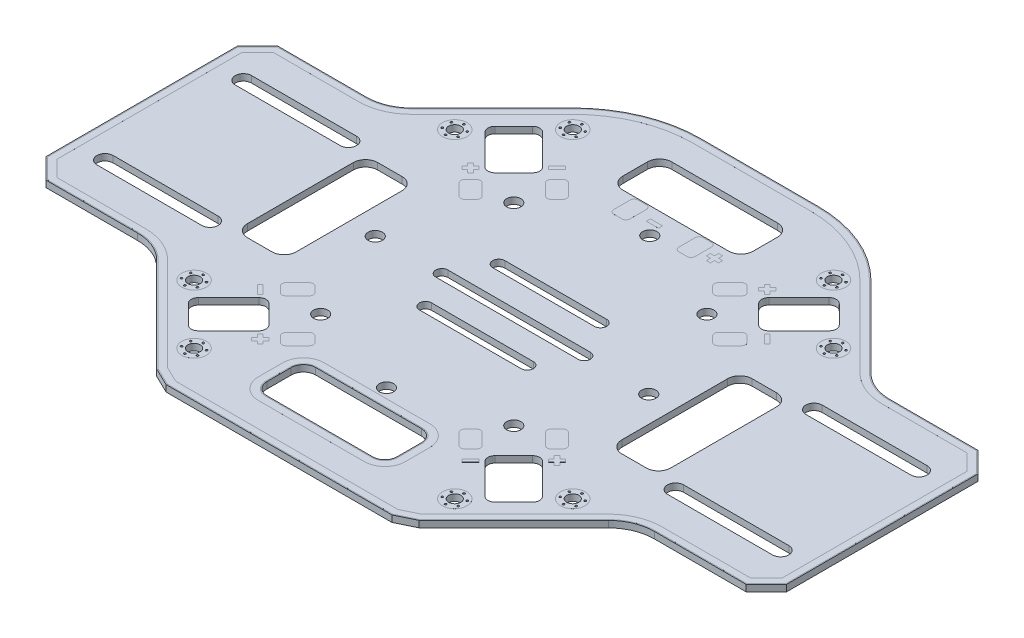
from build123d import *

# Parameters (mm, degrees)
BOSS_EXTRUDE1_DEPTH      = 0.8
BOSS_EXTRUDE1_DEPTH_BACK = 0.8
SKETCH1_R                = 1.5
SKETCH2_R                = 3
SKETCH2_R_2              = 0.25
SKETCH2_R_3              = 1.5
BOSS_EXTRUDE2_DEPTH      = 0.001
BOSS_EXTRUDE4_DEPTH      = 0.001
SKETCH6_R                = 0.25
CUT_EXTRUDE2_DEPTH       = 1.6
SKETCH7_W                = 3
SKETCH7_H                = 1
BOSS_EXTRUDE5_DEPTH      = 0.001
ESBO_O1_R                = 1.75
CORTE_EXTRUS_O1_DEPTH    = 110.18743785
ESBO_O2_R                = 1.75
CORTE_EXTRUS_O2_DEPTH    = 110.18743785


with BuildPart() as part:
    # Sketch1 → Boss-Extrude1 (new, two sides: drawn at the far end of the back side and taken through both)
    with BuildSketch(Plane(origin=(0, 0, 0), x_dir=(1, 0, 0), z_dir=(0, 1, 0)).offset(-BOSS_EXTRUDE1_DEPTH_BACK)):
        with BuildLine():
            Line((-27.75, -57.681401017), (27.75, -57.681401017))
            Line((27.75, -57.681401017), (32.25, -55.501951545))
            Line((32.25, -55.501951545), (55.501951545, -32.25))
            ThreePointArc((55.501951545, -32.25), (59.171487368, -29.798094552), (63.5, -28.937099858))
            Line((63.5, -28.937099858), (86, -28.937099858))
            Line((86, -28.937099858), (91, -23.937099858))
            Line((91, -23.937099858), (91, 23.062900142))
            Line((91, 23.062900142), (86, 28.062900142))
            Line((86, 28.062900142), (64.302117422, 28.062900142))
            ThreePointArc((64.302117422, 28.062900142), (60.040200145, 28.910648198), (56.427121139, 31.324830407))
            Line((56.427121139, 31.324830407), (36.628131265, 51.12382028))
            ThreePointArc((36.628131265, 51.12382028), (26.443529141, 57.928953855), (14.429971817, 60.318598983))
            Line((14.429971817, 60.318598983), (-14.429971817, 60.318598983))
            ThreePointArc((-14.429971817, 60.318598983), (-26.443529141, 57.928953855), (-36.628131265, 51.12382028))
            Line((-36.628131265, 51.12382028), (-56.427121139, 31.324830407))
            ThreePointArc((-56.427121139, 31.324830407), (-60.040200145, 28.910648198), (-64.302117422, 28.062900142))
            Line((-64.302117422, 28.062900142), (-86, 28.062900142))
            Line((-86, 28.062900142), (-91, 23.062900142))
            Line((-91, 23.062900142), (-91, -23.937099858))
            Line((-91, -23.937099858), (-86, -28.937099858))
            Line((-86, -28.937099858), (-63.5, -28.937099858))
            ThreePointArc((-63.5, -28.937099858), (-59.171487368, -29.798094552), (-55.501951545, -32.25))
            Line((-55.501951545, -32.25), (-32.25, -55.501951545))
            Line((-32.25, -55.501951545), (-27.75, -57.681401017))
        make_face()
        with Locations(Location((-32.031937188, 46.527626202, 0), (0, 0, 270))):
            Circle(SKETCH1_R, mode=Mode.SUBTRACT)
        with Locations(Location((-46.527626202, 32.031937188, 0), (0, 0, 270))):
            Circle(SKETCH1_R, mode=Mode.SUBTRACT)
        with Locations(Location((32.031937188, -46.527626202, 0), (0, 0, 270))):
            Circle(SKETCH1_R, mode=Mode.SUBTRACT)
        with Locations(Location((46.527626202, -32.031937188, 0), (0, 0, 270))):
            Circle(SKETCH1_R, mode=Mode.SUBTRACT)
        with Locations(Location((-46.527626202, -32.031937188, 0), (0, 0, 270))):
            Circle(SKETCH1_R, mode=Mode.SUBTRACT)
        with Locations(Location((-32.031937188, -46.527626202, 0), (0, 0, 270))):
            Circle(SKETCH1_R, mode=Mode.SUBTRACT)
        with Locations(Location((32.031937188, 46.527626202, 0), (0, 0, 270))):
            Circle(SKETCH1_R, mode=Mode.SUBTRACT)
        with Locations(Location((46.527626202, 32.031937188, 0), (0, 0, 270))):
            Circle(SKETCH1_R, mode=Mode.SUBTRACT)
        with BuildLine():
            Line((-13, -47.681401017), (13, -47.681401017))
            ThreePointArc((13, -47.681401017), (15.121320344, -46.802721361), (16, -44.681401017))
            Line((16, -44.681401017), (16, -38.681401017))
            ThreePointArc((16, -38.681401017), (15.121320344, -36.560080673), (13, -35.681401017))
            Line((13, -35.681401017), (-13, -35.681401017))
            ThreePointArc((-13, -35.681401017), (-15.121320344, -36.560080673), (-16, -38.681401017))
            Line((-16, -38.681401017), (-16, -44.681401017))
            ThreePointArc((-16, -44.681401017), (-15.121320344, -46.802721361), (-13, -47.681401017))
        make_face(mode=Mode.SUBTRACT)
        with BuildLine():
            Line((37.688791437, -42.284985515), (42.284985515, -37.688791437))
            ThreePointArc((42.284985515, -37.688791437), (42.797548648, -36.45135457), (42.284985515, -35.213917703))
            Line((42.284985515, -35.213917703), (34.860364312, -27.789296501))
            ThreePointArc((34.860364312, -27.789296501), (33.622927445, -27.276733368), (32.385490578, -27.789296501))
            Line((32.385490578, -27.789296501), (27.789296501, -32.385490578))
            ThreePointArc((27.789296501, -32.385490578), (27.276733368, -33.622927445), (27.789296501, -34.860364312))
            Line((27.789296501, -34.860364312), (35.213917703, -42.284985515))
            ThreePointArc((35.213917703, -42.284985515), (36.45135457, -42.797548648), (37.688791437, -42.284985515))
        make_face(mode=Mode.SUBTRACT)
        with BuildLine():
            Line((-35.213917703, -42.284985515), (-27.789296501, -34.860364312))
            ThreePointArc((-27.789296501, -34.860364312), (-27.276733368, -33.622927445), (-27.789296501, -32.385490578))
            Line((-27.789296501, -32.385490578), (-32.385490578, -27.789296501))
            ThreePointArc((-32.385490578, -27.789296501), (-33.622927445, -27.276733368), (-34.860364312, -27.789296501))
            Line((-34.860364312, -27.789296501), (-42.284985515, -35.213917703))
            ThreePointArc((-42.284985515, -35.213917703), (-42.797548648, -36.45135457), (-42.284985515, -37.688791437))
            Line((-42.284985515, -37.688791437), (-37.688791437, -42.284985515))
            ThreePointArc((-37.688791437, -42.284985515), (-36.45135457, -42.797548648), (-35.213917703, -42.284985515))
        make_face(mode=Mode.SUBTRACT)
        with BuildLine():
            Line((-35.213917703, 42.284985515), (-27.789296501, 34.860364312))
            ThreePointArc((-27.789296501, 34.860364312), (-27.276733368, 33.622927445), (-27.789296501, 32.385490578))
            Line((-27.789296501, 32.385490578), (-32.385490578, 27.789296501))
            ThreePointArc((-32.385490578, 27.789296501), (-33.622927445, 27.276733368), (-34.860364312, 27.789296501))
            Line((-34.860364312, 27.789296501), (-42.284985515, 35.213917703))
            ThreePointArc((-42.284985515, 35.213917703), (-42.797548648, 36.45135457), (-42.284985515, 37.688791437))
            Line((-42.284985515, 37.688791437), (-37.688791437, 42.284985515))
            ThreePointArc((-37.688791437, 42.284985515), (-36.45135457, 42.797548648), (-35.213917703, 42.284985515))
        make_face(mode=Mode.SUBTRACT)
        with BuildLine():
            Line((37.688791437, 42.284985515), (42.284985515, 37.688791437))
            ThreePointArc((42.284985515, 37.688791437), (42.797548648, 36.45135457), (42.284985515, 35.213917703))
            Line((42.284985515, 35.213917703), (34.860364312, 27.789296501))
            ThreePointArc((34.860364312, 27.789296501), (33.622927445, 27.276733368), (32.385490578, 27.789296501))
            Line((32.385490578, 27.789296501), (27.789296501, 32.385490578))
            ThreePointArc((27.789296501, 32.385490578), (27.276733368, 33.622927445), (27.789296501, 34.860364312))
            Line((27.789296501, 34.860364312), (35.213917703, 42.284985515))
            ThreePointArc((35.213917703, 42.284985515), (36.45135457, 42.797548648), (37.688791437, 42.284985515))
        make_face(mode=Mode.SUBTRACT)
        with BuildLine():
            Line((-13, 51.818598983), (13, 51.818598983))
            ThreePointArc((13, 51.818598983), (15.121320344, 50.939919327), (16, 48.818598983))
            Line((16, 48.818598983), (16, 42.818598983))
            ThreePointArc((16, 42.818598983), (15.121320344, 40.697278639), (13, 39.818598983))
            Line((13, 39.818598983), (-13, 39.818598983))
            ThreePointArc((-13, 39.818598983), (-15.121320344, 40.697278639), (-16, 42.818598983))
            Line((-16, 42.818598983), (-16, 48.818598983))
            ThreePointArc((-16, 48.818598983), (-15.121320344, 50.939919327), (-13, 51.818598983))
        make_face(mode=Mode.SUBTRACT)
        with BuildLine():
            Line((-12.5, -10.681401017), (12.5, -10.681401017))
            ThreePointArc((12.5, -10.681401017), (14, -9.181401017), (12.5, -7.681401017))
            Line((12.5, -7.681401017), (-12.5, -7.681401017))
            ThreePointArc((-12.5, -7.681401017), (-14, -9.181401017), (-12.5, -10.681401017))
        make_face(mode=Mode.SUBTRACT)
        with BuildLine():
            Line((-17.5, -1.681401017), (17.5, -1.681401017))
            ThreePointArc((17.5, -1.681401017), (19, -0.181401017), (17.5, 1.318598983))
            Line((17.5, 1.318598983), (-17.5, 1.318598983))
            ThreePointArc((-17.5, 1.318598983), (-19, -0.181401017), (-17.5, -1.681401017))
        make_face(mode=Mode.SUBTRACT)
        with BuildLine():
            Line((-12.5, 7.318598983), (12.5, 7.318598983))
            ThreePointArc((12.5, 7.318598983), (14, 8.818598983), (12.5, 10.318598983))
            Line((12.5, 10.318598983), (-12.5, 10.318598983))
            ThreePointArc((-12.5, 10.318598983), (-14, 8.818598983), (-12.5, 7.318598983))
        make_face(mode=Mode.SUBTRACT)
        with BuildLine():
            Line((-52, 12.562900142), (-52, -13.437099858))
            ThreePointArc((-52, -13.437099858), (-51.121320344, -15.558420201), (-49, -16.437099858))
            Line((-49, -16.437099858), (-43, -16.437099858))
            ThreePointArc((-43, -16.437099858), (-40.878679656, -15.558420201), (-40, -13.437099858))
            Line((-40, -13.437099858), (-40, 12.562900142))
            ThreePointArc((-40, 12.562900142), (-40.878679656, 14.684220486), (-43, 15.562900142))
            Line((-43, 15.562900142), (-49, 15.562900142))
            ThreePointArc((-49, 15.562900142), (-51.121320344, 14.684220486), (-52, 12.562900142))
        make_face(mode=Mode.SUBTRACT)
        with BuildLine():
            Line((52, 12.562900142), (52, -13.437099858))
            ThreePointArc((52, -13.437099858), (51.121320344, -15.558420201), (49, -16.437099858))
            Line((49, -16.437099858), (43, -16.437099858))
            ThreePointArc((43, -16.437099858), (40.878679656, -15.558420201), (40, -13.437099858))
            Line((40, -13.437099858), (40, 12.562900142))
            ThreePointArc((40, 12.562900142), (40.878679656, 14.684220486), (43, 15.562900142))
            Line((43, 15.562900142), (49, 15.562900142))
            ThreePointArc((49, 15.562900142), (51.121320344, 14.684220486), (52, 12.562900142))
        make_face(mode=Mode.SUBTRACT)
        with BuildLine():
            Line((-83, 18.562900142), (-57.2, 18.562900142))
            ThreePointArc((-57.2, 18.562900142), (-55.2, 16.562900142), (-57.2, 14.562900142))
            Line((-57.2, 14.562900142), (-83, 14.562900142))
            ThreePointArc((-83, 14.562900142), (-85, 16.562900142), (-83, 18.562900142))
        make_face(mode=Mode.SUBTRACT)
        with BuildLine():
            Line((-83, -15.437099858), (-57.2, -15.437099858))
            ThreePointArc((-57.2, -15.437099858), (-55.2, -17.437099858), (-57.2, -19.437099858))
            Line((-57.2, -19.437099858), (-83, -19.437099858))
            ThreePointArc((-83, -19.437099858), (-85, -17.437099858), (-83, -15.437099858))
        make_face(mode=Mode.SUBTRACT)
        with BuildLine():
            Line((57.2, -15.437099858), (83, -15.437099858))
            ThreePointArc((83, -15.437099858), (85, -17.437099858), (83, -19.437099858))
            Line((83, -19.437099858), (57.2, -19.437099858))
            ThreePointArc((57.2, -19.437099858), (55.2, -17.437099858), (57.2, -15.437099858))
        make_face(mode=Mode.SUBTRACT)
        with BuildLine():
            Line((57.2, 18.562900142), (83, 18.562900142))
            ThreePointArc((83, 18.562900142), (85, 16.562900142), (83, 14.562900142))
            Line((83, 14.562900142), (57.2, 14.562900142))
            ThreePointArc((57.2, 14.562900142), (55.2, 16.562900142), (57.2, 18.562900142))
        make_face(mode=Mode.SUBTRACT)
    extrude(amount=BOSS_EXTRUDE1_DEPTH + BOSS_EXTRUDE1_DEPTH_BACK)

    # Sketch2 → Boss-Extrude2 (add)
    # profile 1 of 10: a face of its own
    with BuildSketch(Plane(origin=(0, 0.8, 0), x_dir=(1, 0, 0), z_dir=(0, 1, 0))):
        with BuildLine():
            ThreePointArc((56.250344443, 31.148053711), (59.944529287, 28.679678315), (64.302117422, 27.812900142))
            Line((64.302117422, 27.812900142), (85.896446609, 27.812900142))
            Line((85.896446609, 27.812900142), (90.75, 22.959346752))
            Line((90.75, 22.959346752), (90.75, -23.833546467))
            Line((90.75, -23.833546467), (85.896446609, -28.687099858))
            Line((85.896446609, -28.687099858), (63.5, -28.687099858))
            ThreePointArc((63.5, -28.687099858), (59.075816509, -29.567124669), (55.32517485, -32.073223305))
            Line((55.32517485, -32.073223305), (32.10305631, -55.295341845))
            Line((32.10305631, -55.295341845), (27.692646067, -57.431401017))
            Line((27.692646067, -57.431401017), (-27.692646067, -57.431401017))
            Line((-27.692646067, -57.431401017), (-32.10305631, -55.295341845))
            Line((-32.10305631, -55.295341845), (-55.32517485, -32.073223305))
            ThreePointArc((-55.32517485, -32.073223305), (-59.075816509, -29.567124669), (-63.5, -28.687099858))
            Line((-63.5, -28.687099858), (-85.896446609, -28.687099858))
            Line((-85.896446609, -28.687099858), (-90.75, -23.833546467))
            Line((-90.75, -23.833546467), (-90.75, 22.959346752))
            Line((-90.75, 22.959346752), (-85.896446609, 27.812900142))
            Line((-85.896446609, 27.812900142), (-64.302117422, 27.812900142))
            ThreePointArc((-64.302117422, 27.812900142), (-59.944529287, 28.679678315), (-56.250344443, 31.148053711))
            Line((-56.250344443, 31.148053711), (-36.45135457, 50.947043584))
            ThreePointArc((-36.45135457, 50.947043584), (-26.347858283, 57.697983972), (-14.429971817, 60.068598983))
            Line((-14.429971817, 60.068598983), (14.429971817, 60.068598983))
            ThreePointArc((14.429971817, 60.068598983), (26.347858283, 57.697983972), (36.45135457, 50.947043584))
            Line((36.45135457, 50.947043584), (56.250344443, 31.148053711))
        make_face()
        with BuildLine():
            Line((-85.212994231, 26.162900142), (-64.302117422, 26.162900142))
            ThreePointArc((-64.302117422, 26.162900142), (-59.313101623, 27.155277086), (-55.083618254, 29.981327522))
            Line((-55.083618254, 29.981327522), (-35.284628381, 49.780317396))
            ThreePointArc((-35.284628381, 49.780317396), (-25.71643062, 56.173582743), (-14.429971817, 58.418598983))
            Line((-14.429971817, 58.418598983), (14.429971817, 58.418598983))
            ThreePointArc((14.429971817, 58.418598983), (25.71643062, 56.173582743), (35.284628381, 49.780317396))
            Line((35.284628381, 49.780317396), (55.083618254, 29.981327522))
            ThreePointArc((55.083618254, 29.981327522), (59.313101623, 27.155277086), (64.302117422, 26.162900142))
            Line((64.302117422, 26.162900142), (85.212994231, 26.162900142))
            Line((85.212994231, 26.162900142), (89.1, 22.275894374))
            Line((89.1, 22.275894374), (89.1, -23.150094089))
            Line((89.1, -23.150094089), (85.212994231, -27.037099858))
            Line((85.212994231, -27.037099858), (63.5, -27.037099858))
            ThreePointArc((63.5, -27.037099858), (58.444388846, -28.042723441), (54.158448661, -30.906497116))
            Line((54.158448661, -30.906497116), (31.133227955, -53.931717821))
            Line((31.133227955, -53.931717821), (27.314110106, -55.781401017))
            Line((27.314110106, -55.781401017), (-27.314110106, -55.781401017))
            Line((-27.314110106, -55.781401017), (-31.133227955, -53.931717821))
            Line((-31.133227955, -53.931717821), (-54.158448661, -30.906497116))
            ThreePointArc((-54.158448661, -30.906497116), (-58.444388846, -28.042723441), (-63.5, -27.037099858))
            Line((-63.5, -27.037099858), (-85.212994231, -27.037099858))
            Line((-85.212994231, -27.037099858), (-89.1, -23.150094089))
            Line((-89.1, -23.150094089), (-89.1, 22.275894374))
            Line((-89.1, 22.275894374), (-85.212994231, 26.162900142))
        make_face(mode=Mode.SUBTRACT)
    # profile 2 of 10: a face of its own
    with BuildSketch(Plane(origin=(0, 0.8, 0), x_dir=(1, 0, 0), z_dir=(0, 1, 0))):
        with Locations(Location((-32.031937188, -46.527626202, 0), (0, 0, 270))):
            Circle(SKETCH2_R)
        with Locations(Location((-33.980494346, -45.402626202, 0), (0, 0, 270))):
            Circle(SKETCH2_R_2, mode=Mode.SUBTRACT)
        with Locations(Location((-33.980494346, -47.652626202, 0), (0, 0, 270))):
            Circle(SKETCH2_R_2, mode=Mode.SUBTRACT)
        with Locations(Location((-32.031937188, -48.777626202, 0), (0, 0, 270))):
            Circle(SKETCH2_R_2, mode=Mode.SUBTRACT)
        with Locations(Location((-30.083380029, -47.652626202, 0), (0, 0, 270))):
            Circle(SKETCH2_R_2, mode=Mode.SUBTRACT)
        with Locations(Location((-30.083380029, -45.402626202, 0), (0, 0, 270))):
            Circle(SKETCH2_R_2, mode=Mode.SUBTRACT)
        with Locations(Location((-32.031937188, -44.277626202, 0), (0, 0, 270))):
            Circle(SKETCH2_R_2, mode=Mode.SUBTRACT)
        with Locations(Location((-32.031937188, -46.527626202, 0), (0, 0, 270))):
            Circle(SKETCH2_R_3, mode=Mode.SUBTRACT)
    # profile 3 of 10: a face of its own
    with BuildSketch(Plane(origin=(0, 0.8, 0), x_dir=(1, 0, 0), z_dir=(0, 1, 0))):
        with Locations(Location((-46.527626202, -32.031937188, 0), (0, 0, 270))):
            Circle(SKETCH2_R)
        with Locations(Location((-48.476183361, -30.906937188, 0), (0, 0, 270))):
            Circle(SKETCH2_R_2, mode=Mode.SUBTRACT)
        with Locations(Location((-48.476183361, -33.156937188, 0), (0, 0, 270))):
            Circle(SKETCH2_R_2, mode=Mode.SUBTRACT)
        with Locations(Location((-46.527626202, -34.281937188, 0), (0, 0, 270))):
            Circle(SKETCH2_R_2, mode=Mode.SUBTRACT)
        with Locations(Location((-44.579069044, -33.156937188, 0), (0, 0, 270))):
            Circle(SKETCH2_R_2, mode=Mode.SUBTRACT)
        with Locations(Location((-44.579069044, -30.906937188, 0), (0, 0, 270))):
            Circle(SKETCH2_R_2, mode=Mode.SUBTRACT)
        with Locations(Location((-46.527626202, -29.781937188, 0), (0, 0, 270))):
            Circle(SKETCH2_R_2, mode=Mode.SUBTRACT)
        with Locations(Location((-46.527626202, -32.031937188, 0), (0, 0, 270))):
            Circle(SKETCH2_R_3, mode=Mode.SUBTRACT)
    # profile 4 of 10: a face of its own
    with BuildSketch(Plane(origin=(0, 0.8, 0), x_dir=(1, 0, 0), z_dir=(0, 1, 0))):
        with Locations(Location((-46.527626202, 32.031937188, 0), (0, 0, 270))):
            Circle(SKETCH2_R)
        with Locations(Location((-48.476183361, 30.906937188, 0), (0, 0, 270))):
            Circle(SKETCH2_R_2, mode=Mode.SUBTRACT)
        with Locations(Location((-48.476183361, 33.156937188, 0), (0, 0, 270))):
            Circle(SKETCH2_R_2, mode=Mode.SUBTRACT)
        with Locations(Location((-46.527626202, 34.281937188, 0), (0, 0, 270))):
            Circle(SKETCH2_R_2, mode=Mode.SUBTRACT)
        with Locations(Location((-44.579069044, 33.156937188, 0), (0, 0, 270))):
            Circle(SKETCH2_R_2, mode=Mode.SUBTRACT)
        with Locations(Location((-44.579069044, 30.906937188, 0), (0, 0, 270))):
            Circle(SKETCH2_R_2, mode=Mode.SUBTRACT)
        with Locations(Location((-46.527626202, 29.781937188, 0), (0, 0, 270))):
            Circle(SKETCH2_R_2, mode=Mode.SUBTRACT)
        with Locations(Location((-46.527626202, 32.031937188, 0), (0, 0, 270))):
            Circle(SKETCH2_R_3, mode=Mode.SUBTRACT)
    # profile 5 of 10: a face of its own
    with BuildSketch(Plane(origin=(0, 0.8, 0), x_dir=(1, 0, 0), z_dir=(0, 1, 0))):
        with Locations(Location((-32.031937188, 46.527626202, 0), (0, 0, 270))):
            Circle(SKETCH2_R)
        with Locations(Location((-33.980494346, 45.402626202, 0), (0, 0, 270))):
            Circle(SKETCH2_R_2, mode=Mode.SUBTRACT)
        with Locations(Location((-33.980494346, 47.652626202, 0), (0, 0, 270))):
            Circle(SKETCH2_R_2, mode=Mode.SUBTRACT)
        with Locations(Location((-32.031937188, 44.277626202, 0), (0, 0, 270))):
            Circle(SKETCH2_R_2, mode=Mode.SUBTRACT)
        with Locations(Location((-30.083380029, 45.402626202, 0), (0, 0, 270))):
            Circle(SKETCH2_R_2, mode=Mode.SUBTRACT)
        with Locations(Location((-30.083380029, 47.652626202, 0), (0, 0, 270))):
            Circle(SKETCH2_R_2, mode=Mode.SUBTRACT)
        with Locations(Location((-32.031937188, 48.777626202, 0), (0, 0, 270))):
            Circle(SKETCH2_R_2, mode=Mode.SUBTRACT)
        with Locations(Location((-32.031937188, 46.527626202, 0), (0, 0, 270))):
            Circle(SKETCH2_R_3, mode=Mode.SUBTRACT)
    # profile 6 of 10: a face of its own
    with BuildSketch(Plane(origin=(0, 0.8, 0), x_dir=(1, 0, 0), z_dir=(0, 1, 0))):
        with Locations(Location((32.031937188, 46.527626202, 0), (0, 0, 270))):
            Circle(SKETCH2_R)
        with Locations(Location((30.083380029, 45.402626202, 0), (0, 0, 270))):
            Circle(SKETCH2_R_2, mode=Mode.SUBTRACT)
        with Locations(Location((30.083380029, 47.652626202, 0), (0, 0, 270))):
            Circle(SKETCH2_R_2, mode=Mode.SUBTRACT)
        with Locations(Location((32.031937188, 48.777626202, 0), (0, 0, 270))):
            Circle(SKETCH2_R_2, mode=Mode.SUBTRACT)
        with Locations(Location((33.980494346, 47.652626202, 0), (0, 0, 270))):
            Circle(SKETCH2_R_2, mode=Mode.SUBTRACT)
        with Locations(Location((33.980494346, 45.402626202, 0), (0, 0, 270))):
            Circle(SKETCH2_R_2, mode=Mode.SUBTRACT)
        with Locations(Location((32.031937188, 44.277626202, 0), (0, 0, 270))):
            Circle(SKETCH2_R_2, mode=Mode.SUBTRACT)
        with Locations(Location((32.031937188, 46.527626202, 0), (0, 0, 270))):
            Circle(SKETCH2_R_3, mode=Mode.SUBTRACT)
    # profile 7 of 10: a face of its own
    with BuildSketch(Plane(origin=(0, 0.8, 0), x_dir=(1, 0, 0), z_dir=(0, 1, 0))):
        with Locations(Location((46.527626202, 32.031937188, 0), (0, 0, 270))):
            Circle(SKETCH2_R)
        with Locations(Location((44.579069044, 30.906937188, 0), (0, 0, 270))):
            Circle(SKETCH2_R_2, mode=Mode.SUBTRACT)
        with Locations(Location((44.579069044, 33.156937188, 0), (0, 0, 270))):
            Circle(SKETCH2_R_2, mode=Mode.SUBTRACT)
        with Locations(Location((46.527626202, 34.281937188, 0), (0, 0, 270))):
            Circle(SKETCH2_R_2, mode=Mode.SUBTRACT)
        with Locations(Location((48.476183361, 33.156937188, 0), (0, 0, 270))):
            Circle(SKETCH2_R_2, mode=Mode.SUBTRACT)
        with Locations(Location((48.476183361, 30.906937188, 0), (0, 0, 270))):
            Circle(SKETCH2_R_2, mode=Mode.SUBTRACT)
        with Locations(Location((46.527626202, 29.781937188, 0), (0, 0, 270))):
            Circle(SKETCH2_R_2, mode=Mode.SUBTRACT)
        with Locations(Location((46.527626202, 32.031937188, 0), (0, 0, 270))):
            Circle(SKETCH2_R_3, mode=Mode.SUBTRACT)
    # profile 8 of 10: a face of its own
    with BuildSketch(Plane(origin=(0, 0.8, 0), x_dir=(1, 0, 0), z_dir=(0, 1, 0))):
        with Locations(Location((46.527626202, -32.031937188, 0), (0, 0, 270))):
            Circle(SKETCH2_R)
        with Locations(Location((44.579069044, -33.156937188, 0), (0, 0, 270))):
            Circle(SKETCH2_R_2, mode=Mode.SUBTRACT)
        with Locations(Location((44.579069044, -30.906937188, 0), (0, 0, 270))):
            Circle(SKETCH2_R_2, mode=Mode.SUBTRACT)
        with Locations(Location((46.527626202, -29.781937188, 0), (0, 0, 270))):
            Circle(SKETCH2_R_2, mode=Mode.SUBTRACT)
        with Locations(Location((48.476183361, -30.906937188, 0), (0, 0, 270))):
            Circle(SKETCH2_R_2, mode=Mode.SUBTRACT)
        with Locations(Location((48.476183361, -33.156937188, 0), (0, 0, 270))):
            Circle(SKETCH2_R_2, mode=Mode.SUBTRACT)
        with Locations(Location((46.527626202, -34.281937188, 0), (0, 0, 270))):
            Circle(SKETCH2_R_2, mode=Mode.SUBTRACT)
        with Locations(Location((46.527626202, -32.031937188, 0), (0, 0, 270))):
            Circle(SKETCH2_R_3, mode=Mode.SUBTRACT)
    # profile 9 of 10: a face of its own
    with BuildSketch(Plane(origin=(0, 0.8, 0), x_dir=(1, 0, 0), z_dir=(0, 1, 0))):
        with Locations(Location((32.031937188, -46.527626202, 0), (0, 0, 270))):
            Circle(SKETCH2_R)
        with Locations(Location((30.083380029, -45.402626202, 0), (0, 0, 270))):
            Circle(SKETCH2_R_2, mode=Mode.SUBTRACT)
        with Locations(Location((30.083380029, -47.652626202, 0), (0, 0, 270))):
            Circle(SKETCH2_R_2, mode=Mode.SUBTRACT)
        with Locations(Location((32.031937188, -48.777626202, 0), (0, 0, 270))):
            Circle(SKETCH2_R_2, mode=Mode.SUBTRACT)
        with Locations(Location((33.980494346, -47.652626202, 0), (0, 0, 270))):
            Circle(SKETCH2_R_2, mode=Mode.SUBTRACT)
        with Locations(Location((33.980494346, -45.402626202, 0), (0, 0, 270))):
            Circle(SKETCH2_R_2, mode=Mode.SUBTRACT)
        with Locations(Location((32.031937188, -44.277626202, 0), (0, 0, 270))):
            Circle(SKETCH2_R_2, mode=Mode.SUBTRACT)
        with Locations(Location((32.031937188, -46.527626202, 0), (0, 0, 270))):
            Circle(SKETCH2_R_3, mode=Mode.SUBTRACT)
    # profile 10 of 10: a face of its own
    with BuildSketch(Plane(origin=(0, 0.8, 0), x_dir=(1, 0, 0), z_dir=(0, 1, 0))):
        with BuildLine():
            Line((-13, -33.631401017), (13, -33.631401017))
            ThreePointArc((13, -33.631401017), (16.570889245, -35.110511772), (18.05, -38.681401017))
            Line((18.05, -38.681401017), (18.05, -44.681401017))
            ThreePointArc((18.05, -44.681401017), (16.570889245, -48.252290262), (13, -49.731401017))
            Line((13, -49.731401017), (-13, -49.731401017))
            ThreePointArc((-13, -49.731401017), (-16.570889245, -48.252290262), (-18.05, -44.681401017))
            Line((-18.05, -44.681401017), (-18.05, -38.681401017))
            ThreePointArc((-18.05, -38.681401017), (-16.570889245, -35.110511772), (-13, -33.631401017))
        make_face()
        with BuildLine():
            ThreePointArc((13, -47.931401017), (15.298097039, -46.979498056), (16.25, -44.681401017))
            Line((16.25, -44.681401017), (16.25, -38.681401017))
            ThreePointArc((16.25, -38.681401017), (15.298097039, -36.383303978), (13, -35.431401017))
            Line((13, -35.431401017), (-13, -35.431401017))
            ThreePointArc((-13, -35.431401017), (-15.298097039, -36.383303978), (-16.25, -38.681401017))
            Line((-16.25, -38.681401017), (-16.25, -44.681401017))
            ThreePointArc((-16.25, -44.681401017), (-15.298097039, -46.979498056), (-13, -47.931401017))
            Line((-13, -47.931401017), (13, -47.931401017))
        make_face(mode=Mode.SUBTRACT)
    boss_extrude2 = extrude(amount=BOSS_EXTRUDE2_DEPTH)

    # Mirror1: Boss-Extrude2 across plane
    add(boss_extrude2.mirror(Plane.ZX))

    # Sketch5 → Boss-Extrude4 (add)
    with BuildSketch(Plane(origin=(0, 0.8, 0), x_dir=(1, 0, 0), z_dir=(0, 1, 0))):
        Polygon((35.744247789, -27.258966415), (36.45135457, -26.551859634), (37.158461351, -27.258966415), (37.865568133, -26.551859634), (37.158461351, -25.844752852), (37.865568133, -25.137646071), (37.158461351, -24.43053929), (36.45135457, -25.137646071), (35.744247789, -24.43053929), (35.037141008, -25.137646071), (35.744247789, -25.844752852), (35.037141008, -26.551859634), align=None)
        Polygon((26.551859634, -35.037141008), (27.258966415, -35.744247789), (25.137646071, -37.865568133), (24.43053929, -37.158461351), align=None)
        Polygon((-37.158461351, -24.43053929), (-37.865568133, -25.137646071), (-35.744247789, -27.258966415), (-35.037141008, -26.551859634), align=None)
        Polygon((-26.551859634, -35.037141008), (-27.258966415, -35.744247789), (-26.551859634, -36.45135457), (-27.258966415, -37.158461351), (-26.551859634, -37.865568133), (-25.844752852, -37.158461351), (-25.137646071, -37.865568133), (-24.43053929, -37.158461351), (-25.137646071, -36.45135457), (-24.43053929, -35.744247789), (-25.137646071, -35.037141008), (-25.844752852, -35.744247789), align=None)
        Polygon((-24.43053929, 37.158461351), (-25.137646071, 37.865568133), (-27.258966415, 35.744247789), (-26.551859634, 35.037141008), align=None)
        Polygon((-35.037141008, 26.551859634), (-35.744247789, 27.258966415), (-36.45135457, 26.551859634), (-37.158461351, 27.258966415), (-37.865568133, 26.551859634), (-37.158461351, 25.844752852), (-37.865568133, 25.137646071), (-37.158461351, 24.43053929), (-36.45135457, 25.137646071), (-35.744247789, 24.43053929), (-35.037141008, 25.137646071), (-35.744247789, 25.844752852), align=None)
        Polygon((37.158461351, 24.43053929), (37.865568133, 25.137646071), (35.744247789, 27.258966415), (35.037141008, 26.551859634), align=None)
        Polygon((26.551859634, 35.037141008), (27.258966415, 35.744247789), (26.551859634, 36.45135457), (27.258966415, 37.158461351), (26.551859634, 37.865568133), (25.844752852, 37.158461351), (25.137646071, 37.865568133), (24.43053929, 37.158461351), (25.137646071, 36.45135457), (24.43053929, 35.744247789), (25.137646071, 35.037141008), (25.844752852, 35.744247789), align=None)
        with BuildLine():
            Line((29.026733368, -19.834345212), (30.44094693, -18.42013165))
            ThreePointArc((30.44094693, -18.42013165), (31.148053711, -18.127238431), (31.855160492, -18.42013165))
            Line((31.855160492, -18.42013165), (34.683587617, -21.248558775))
            ThreePointArc((34.683587617, -21.248558775), (34.976480836, -21.955665556), (34.683587617, -22.662772337))
            Line((34.683587617, -22.662772337), (33.269374055, -24.076985899))
            ThreePointArc((33.269374055, -24.076985899), (32.562267274, -24.369879118), (31.855160492, -24.076985899))
            Line((31.855160492, -24.076985899), (29.026733368, -21.248558775))
            ThreePointArc((29.026733368, -21.248558775), (28.733840149, -20.541451993), (29.026733368, -19.834345212))
        make_face()
        with BuildLine():
            Line((18.42013165, -31.855160492), (21.248558775, -34.683587617))
            ThreePointArc((21.248558775, -34.683587617), (21.955665556, -34.976480836), (22.662772337, -34.683587617))
            Line((22.662772337, -34.683587617), (24.076985899, -33.269374055))
            ThreePointArc((24.076985899, -33.269374055), (24.369879118, -32.562267274), (24.076985899, -31.855160492))
            Line((24.076985899, -31.855160492), (21.248558775, -29.026733368))
            ThreePointArc((21.248558775, -29.026733368), (20.541451993, -28.733840149), (19.834345212, -29.026733368))
            Line((19.834345212, -29.026733368), (18.42013165, -30.44094693))
            ThreePointArc((18.42013165, -30.44094693), (18.127238431, -31.148053711), (18.42013165, -31.855160492))
        make_face()
        with BuildLine():
            Line((-34.683587617, -22.662772337), (-33.269374055, -24.076985899))
            ThreePointArc((-33.269374055, -24.076985899), (-32.562267274, -24.369879118), (-31.855160492, -24.076985899))
            Line((-31.855160492, -24.076985899), (-29.026733368, -21.248558775))
            ThreePointArc((-29.026733368, -21.248558775), (-28.733840149, -20.541451993), (-29.026733368, -19.834345212))
            Line((-29.026733368, -19.834345212), (-30.44094693, -18.42013165))
            ThreePointArc((-30.44094693, -18.42013165), (-31.148053711, -18.127238431), (-31.855160492, -18.42013165))
            Line((-31.855160492, -18.42013165), (-34.683587617, -21.248558775))
            ThreePointArc((-34.683587617, -21.248558775), (-34.976480836, -21.955665556), (-34.683587617, -22.662772337))
        make_face()
        with BuildLine():
            Line((-21.248558775, -29.026733368), (-24.076985899, -31.855160492))
            ThreePointArc((-24.076985899, -31.855160492), (-24.369879118, -32.562267274), (-24.076985899, -33.269374055))
            Line((-24.076985899, -33.269374055), (-22.662772337, -34.683587617))
            ThreePointArc((-22.662772337, -34.683587617), (-21.955665556, -34.976480836), (-21.248558775, -34.683587617))
            Line((-21.248558775, -34.683587617), (-18.42013165, -31.855160492))
            ThreePointArc((-18.42013165, -31.855160492), (-18.127238431, -31.148053711), (-18.42013165, -30.44094693))
            Line((-18.42013165, -30.44094693), (-19.834345212, -29.026733368))
            ThreePointArc((-19.834345212, -29.026733368), (-20.541451993, -28.733840149), (-21.248558775, -29.026733368))
        make_face()
        with BuildLine():
            Line((-22.662772337, 34.683587617), (-24.076985899, 33.269374055))
            ThreePointArc((-24.076985899, 33.269374055), (-24.369879118, 32.562267274), (-24.076985899, 31.855160492))
            Line((-24.076985899, 31.855160492), (-21.248558775, 29.026733368))
            ThreePointArc((-21.248558775, 29.026733368), (-20.541451993, 28.733840149), (-19.834345212, 29.026733368))
            Line((-19.834345212, 29.026733368), (-18.42013165, 30.44094693))
            ThreePointArc((-18.42013165, 30.44094693), (-18.127238431, 31.148053711), (-18.42013165, 31.855160492))
            Line((-18.42013165, 31.855160492), (-21.248558775, 34.683587617))
            ThreePointArc((-21.248558775, 34.683587617), (-21.955665556, 34.976480836), (-22.662772337, 34.683587617))
        make_face()
        with BuildLine():
            Line((-29.026733368, 21.248558775), (-31.855160492, 24.076985899))
            ThreePointArc((-31.855160492, 24.076985899), (-32.562267274, 24.369879118), (-33.269374055, 24.076985899))
            Line((-33.269374055, 24.076985899), (-34.683587617, 22.662772337))
            ThreePointArc((-34.683587617, 22.662772337), (-34.976480836, 21.955665556), (-34.683587617, 21.248558775))
            Line((-34.683587617, 21.248558775), (-31.855160492, 18.42013165))
            ThreePointArc((-31.855160492, 18.42013165), (-31.148053711, 18.127238431), (-30.44094693, 18.42013165))
            Line((-30.44094693, 18.42013165), (-29.026733368, 19.834345212))
            ThreePointArc((-29.026733368, 19.834345212), (-28.733840149, 20.541451993), (-29.026733368, 21.248558775))
        make_face()
        with BuildLine():
            Line((34.683587617, 22.662772337), (33.269374055, 24.076985899))
            ThreePointArc((33.269374055, 24.076985899), (32.562267274, 24.369879118), (31.855160492, 24.076985899))
            Line((31.855160492, 24.076985899), (29.026733368, 21.248558775))
            ThreePointArc((29.026733368, 21.248558775), (28.733840149, 20.541451993), (29.026733368, 19.834345212))
            Line((29.026733368, 19.834345212), (30.44094693, 18.42013165))
            ThreePointArc((30.44094693, 18.42013165), (31.148053711, 18.127238431), (31.855160492, 18.42013165))
            Line((31.855160492, 18.42013165), (34.683587617, 21.248558775))
            ThreePointArc((34.683587617, 21.248558775), (34.976480836, 21.955665556), (34.683587617, 22.662772337))
        make_face()
        with BuildLine():
            Line((21.248558775, 29.026733368), (24.076985899, 31.855160492))
            ThreePointArc((24.076985899, 31.855160492), (24.369879118, 32.562267274), (24.076985899, 33.269374055))
            Line((24.076985899, 33.269374055), (22.662772337, 34.683587617))
            ThreePointArc((22.662772337, 34.683587617), (21.955665556, 34.976480836), (21.248558775, 34.683587617))
            Line((21.248558775, 34.683587617), (18.42013165, 31.855160492))
            ThreePointArc((18.42013165, 31.855160492), (18.127238431, 31.148053711), (18.42013165, 30.44094693))
            Line((18.42013165, 30.44094693), (19.834345212, 29.026733368))
            ThreePointArc((19.834345212, 29.026733368), (20.541451993, 28.733840149), (21.248558775, 29.026733368))
        make_face()
    extrude(amount=BOSS_EXTRUDE4_DEPTH)

    # Sketch6 → Cut-Extrude2 (cut)
    with BuildSketch(Plane(origin=(0, 0.8, 0), x_dir=(1, 0, 0), z_dir=(0, 1, 0))):
        with Locations(Location((-48.476183361, 33.156937188, 0), (0, 0, 270))):
            Circle(SKETCH6_R)
        with Locations(Location((-46.527626202, 34.281937188, 0), (0, 0, 270))):
            Circle(SKETCH6_R)
        with Locations(Location((-44.579069044, 33.156937188, 0), (0, 0, 270))):
            Circle(SKETCH6_R)
        with Locations(Location((-48.476183361, 30.906937188, 0), (0, 0, 270))):
            Circle(SKETCH6_R)
        with Locations(Location((-46.527626202, 29.781937188, 0), (0, 0, 270))):
            Circle(SKETCH6_R)
        with Locations(Location((-44.579069044, 30.906937188, 0), (0, 0, 270))):
            Circle(SKETCH6_R)
        with Locations(Location((-33.980494346, 45.402626202, 0), (0, 0, 270))):
            Circle(SKETCH6_R)
        with Locations(Location((-32.031937188, 48.777626202, 0), (0, 0, 270))):
            Circle(SKETCH6_R)
        with Locations(Location((-33.980494346, 47.652626202, 0), (0, 0, 270))):
            Circle(SKETCH6_R)
        with Locations(Location((-32.031937188, 44.277626202, 0), (0, 0, 270))):
            Circle(SKETCH6_R)
        with Locations(Location((-30.083380029, 47.652626202, 0), (0, 0, 270))):
            Circle(SKETCH6_R)
        with Locations(Location((-30.083380029, 45.402626202, 0), (0, 0, 270))):
            Circle(SKETCH6_R)
        with Locations(Location((30.083380029, 47.652626202, 0), (0, 0, 270))):
            Circle(SKETCH6_R)
        with Locations(Location((32.031937188, 48.777626202, 0), (0, 0, 270))):
            Circle(SKETCH6_R)
        with Locations(Location((33.980494346, 47.652626202, 0), (0, 0, 270))):
            Circle(SKETCH6_R)
        with Locations(Location((33.980494346, 45.402626202, 0), (0, 0, 270))):
            Circle(SKETCH6_R)
        with Locations(Location((30.083380029, 45.402626202, 0), (0, 0, 270))):
            Circle(SKETCH6_R)
        with Locations(Location((32.031937188, 44.277626202, 0), (0, 0, 270))):
            Circle(SKETCH6_R)
        with Locations(Location((46.527626202, 34.281937188, 0), (0, 0, 270))):
            Circle(SKETCH6_R)
        with Locations(Location((48.476183361, 30.906937188, 0), (0, 0, 270))):
            Circle(SKETCH6_R)
        with Locations(Location((44.579069044, 33.156937188, 0), (0, 0, 270))):
            Circle(SKETCH6_R)
        with Locations(Location((48.476183361, 33.156937188, 0), (0, 0, 270))):
            Circle(SKETCH6_R)
        with Locations(Location((46.527626202, 29.781937188, 0), (0, 0, 270))):
            Circle(SKETCH6_R)
        with Locations(Location((44.579069044, 30.906937188, 0), (0, 0, 270))):
            Circle(SKETCH6_R)
        with Locations(Location((44.579069044, -30.906937188, 0), (0, 0, 270))):
            Circle(SKETCH6_R)
        with Locations(Location((46.527626202, -29.781937188, 0), (0, 0, 270))):
            Circle(SKETCH6_R)
        with Locations(Location((44.579069044, -33.156937188, 0), (0, 0, 270))):
            Circle(SKETCH6_R)
        with Locations(Location((48.476183361, -33.156937188, 0), (0, 0, 270))):
            Circle(SKETCH6_R)
        with Locations(Location((48.476183361, -30.906937188, 0), (0, 0, 270))):
            Circle(SKETCH6_R)
        with Locations(Location((46.527626202, -34.281937188, 0), (0, 0, 270))):
            Circle(SKETCH6_R)
        with Locations(Location((32.031937188, -44.277626202, 0), (0, 0, 270))):
            Circle(SKETCH6_R)
        with Locations(Location((30.083380029, -45.402626202, 0), (0, 0, 270))):
            Circle(SKETCH6_R)
        with Locations(Location((30.083380029, -47.652626202, 0), (0, 0, 270))):
            Circle(SKETCH6_R)
        with Locations(Location((33.980494346, -47.652626202, 0), (0, 0, 270))):
            Circle(SKETCH6_R)
        with Locations(Location((32.031937188, -48.777626202, 0), (0, 0, 270))):
            Circle(SKETCH6_R)
        with Locations(Location((33.980494346, -45.402626202, 0), (0, 0, 270))):
            Circle(SKETCH6_R)
        with Locations(Location((-48.476183361, -30.906937188, 0), (0, 0, 270))):
            Circle(SKETCH6_R)
        with Locations(Location((-44.579069044, -30.906937188, 0), (0, 0, 270))):
            Circle(SKETCH6_R)
        with Locations(Location((-48.476183361, -33.156937188, 0), (0, 0, 270))):
            Circle(SKETCH6_R)
        with Locations(Location((-46.527626202, -34.281937188, 0), (0, 0, 270))):
            Circle(SKETCH6_R)
        with Locations(Location((-44.579069044, -33.156937188, 0), (0, 0, 270))):
            Circle(SKETCH6_R)
        with Locations(Location((-46.527626202, -29.781937188, 0), (0, 0, 270))):
            Circle(SKETCH6_R)
        with Locations(Location((-33.980494346, -45.402626202, 0), (0, 0, 270))):
            Circle(SKETCH6_R)
        with Locations(Location((-32.031937188, -44.277626202, 0), (0, 0, 270))):
            Circle(SKETCH6_R)
        with Locations(Location((-30.083380029, -45.402626202, 0), (0, 0, 270))):
            Circle(SKETCH6_R)
        with Locations(Location((-30.083380029, -47.652626202, 0), (0, 0, 270))):
            Circle(SKETCH6_R)
        with Locations(Location((-33.980494346, -47.652626202, 0), (0, 0, 270))):
            Circle(SKETCH6_R)
        with Locations(Location((-32.031937188, -48.777626202, 0), (0, 0, 270))):
            Circle(SKETCH6_R)
    extrude(amount=-CUT_EXTRUDE2_DEPTH, mode=Mode.SUBTRACT)

    # Sketch7 → Boss-Extrude5 (add)
    with BuildSketch(Plane(origin=(0, 0.8, 0), x_dir=(1, 0, 0), z_dir=(0, 1, 0))):
        with BuildLine():
            Line((9, 39.568598983), (7, 39.568598983))
            ThreePointArc((7, 39.568598983), (6.292893219, 39.275705764), (6, 38.568598983))
            Line((6, 38.568598983), (6, 34.568598983))
            ThreePointArc((6, 34.568598983), (6.292893219, 33.861492202), (7, 33.568598983))
            Line((7, 33.568598983), (9, 33.568598983))
            ThreePointArc((9, 33.568598983), (9.707106781, 33.861492202), (10, 34.568598983))
            Line((10, 34.568598983), (10, 38.568598983))
            ThreePointArc((10, 38.568598983), (9.707106781, 39.275705764), (9, 39.568598983))
        make_face()
        with BuildLine():
            Line((-7, 39.568598983), (-9, 39.568598983))
            ThreePointArc((-9, 39.568598983), (-9.707106781, 39.275705764), (-10, 38.568598983))
            Line((-10, 38.568598983), (-10, 34.568598983))
            ThreePointArc((-10, 34.568598983), (-9.707106781, 33.861492202), (-9, 33.568598983))
            Line((-9, 33.568598983), (-7, 33.568598983))
            ThreePointArc((-7, 33.568598983), (-6.292893219, 33.861492202), (-6, 34.568598983))
            Line((-6, 34.568598983), (-6, 38.568598983))
            ThreePointArc((-6, 38.568598983), (-6.292893219, 39.275705764), (-7, 39.568598983))
        make_face()
        with Locations((-2, 36.568598983)):
            Rectangle(SKETCH7_W, SKETCH7_H)
        Polygon((14.25, 36.068598983), (13.25, 36.068598983), (13.25, 35.068598983), (12.25, 35.068598983), (12.25, 36.068598983), (11.25, 36.068598983), (11.25, 37.068598983), (12.25, 37.068598983), (12.25, 38.068598983), (13.25, 38.068598983), (13.25, 37.068598983), (14.25, 37.068598983), align=None)
    extrude(amount=BOSS_EXTRUDE5_DEPTH)

    # Esboço1 → Corte-extrusão1 (cut, through all)
    with BuildSketch(Plane(origin=(0, 0.8, 0), x_dir=(1, 0, 0), z_dir=(0, 1, 0))):
        with Locations(Location((-33.6, -0.437099858, 0), (0, 0, 270))):
            Circle(ESBO_O1_R)
        with Locations(Location((33.6, -0.437099858, 0), (0, 0, 270))):
            Circle(ESBO_O1_R)
        with Locations(Location((0, 33.418598983, 0), (0, 0, 270))):
            Circle(ESBO_O1_R)
        with Locations(Location((0, -31.281401017, 0), (0, 0, 270))):
            Circle(ESBO_O1_R)
    extrude(amount=-CORTE_EXTRUS_O1_DEPTH, mode=Mode.SUBTRACT)

    # Esboço2 → Corte-extrusão2 (cut, through all)
    with BuildSketch(Plane(origin=(0, 0.8, 0), x_dir=(1, 0, 0), z_dir=(0, 1, 0))):
        with Locations(Location((23.723432509, 23.723432509, 0), (0, 0, 270))):
            Circle(ESBO_O2_R)
        with Locations(Location((-23.723432509, -23.723432509, 0), (0, 0, 270))):
            Circle(ESBO_O2_R)
        with Locations(Location((23.723432509, -23.723432509, 0), (0, 0, 270))):
            Circle(ESBO_O2_R)
        with Locations(Location((-23.723432509, 23.723432509, 0), (0, 0, 270))):
            Circle(ESBO_O2_R)
    extrude(amount=-CORTE_EXTRUS_O2_DEPTH, mode=Mode.SUBTRACT)


solid = part.part
